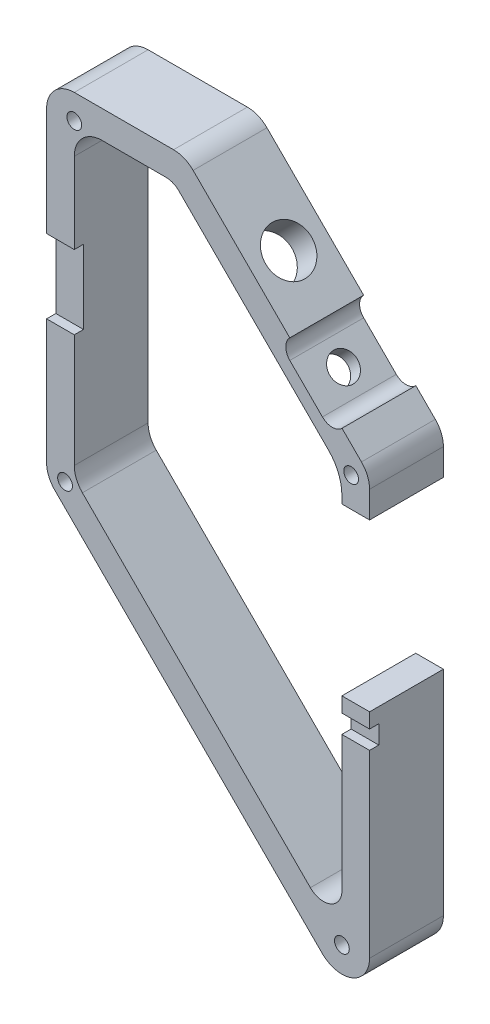
from build123d import *

# Parameters (mm, degrees)
EXTRUDE_1079_DEPTH     = 8
FILLET_4_R             = 3
FILLET_5_R             = 2
SKETCH_13_W            = 3
SKETCH_13_H            = 8
SKETCH_13_H_2          = 2
CUT_EXTRUDE_2700_DEPTH = 1
HOLE_WIZARD_M2_D       = 1.6
FILLET_6_R             = 3
FILLET_7_R             = 5
SKETCH_19_W            = 4
SKETCH_19_H            = 18
CUT_EXTRUDE_4512_DEPTH = 62.155364655
CUT_EXTRUDE_1_REACH    = 71.276
SKETCH_20_R            = 2.5
SKETCH_20_R_2          = 1.5
CUT_EXTRUDE_2_DEPTH    = 62.155364655
FILLET_8_R             = 1.5


with BuildPart() as part:
    # Эскиз8 → Extrude 1079 (new body)
    with BuildSketch(Plane.XY):
        Polygon((0, -18.75), (0, 18.75), (15, 18.75), (35, -1.25), (35, -53.75), align=None)
        Polygon((32, -46.507359313), (3, -17.507359313), (3, 15.75), (13.757359313, 15.75), (32, -2.492640687), align=None, mode=Mode.SUBTRACT)
    extrude(amount=-EXTRUDE_1079_DEPTH)

    # Скругление4
    fillet_4_edges = [part.edges().sort_by_distance(p)[0] for p in [
        (3, -17.507359313, -4),
        (3, 15.75, -4),
        (15, 18.75, -4),
        (35, -1.25, -4),
        (0, -18.75, -4),
        (0, 18.75, -4),
    ]]
    fillet(fillet_4_edges, radius=FILLET_4_R)

    # Скругление5
    fillet_5_edges = [part.edges().sort_by_distance(p)[0] for p in [
        (13.757359313, 15.75, -4),
        (32, -46.507359313, -4),
    ]]
    fillet(fillet_5_edges, radius=FILLET_5_R)

    # Эскиз13 → Cut-Extrude 2700 (cut)
    with BuildSketch(Plane(origin=(0, 0, 0), x_dir=(-1, 0, 0), z_dir=(0, 0, -1))):
        with Locations((-1.5, 0)):
            Rectangle(SKETCH_13_W, SKETCH_13_H)
        with Locations((-33.5, -26)):
            Rectangle(SKETCH_13_W, SKETCH_13_H_2)
    extrude(amount=CUT_EXTRUDE_2700_DEPTH, mode=Mode.SUBTRACT)

    # Крепление рамки M2 (through all)
    with Locations(Plane.XY):
        with Locations((2, -18.3), (3, 16.07), (32, -46.75), (33, -2.17)):
            Hole(HOLE_WIZARD_M2_D / 2)

    # Скругление6
    fillet_6_edges = [part.edges().sort_by_distance(p)[0] for p in [
        (35, -53.75, -4),
    ]]
    fillet(fillet_6_edges, radius=FILLET_6_R)

    # Скругление7
    fillet_7_edges = [part.edges().sort_by_distance(p)[0] for p in [
        (32, -2.492640687, -4),
    ]]
    fillet(fillet_7_edges, radius=FILLET_7_R)

    # Эскиз19 → Cut-Extrude 4512 (cut, through all)
    with BuildSketch(Plane.XY):
        with Locations((33, -14.38)):
            Rectangle(SKETCH_19_W, SKETCH_19_H)
    extrude(amount=-CUT_EXTRUDE_4512_DEPTH, mode=Mode.SUBTRACT)

    # Эскиз20 → Вырез-Вытянуть1 (cut, up to next)
    with BuildSketch(Plane(origin=(16.875, 16.875, 0), x_dir=(0, 0, -1), z_dir=(0.7071067811865488, 0.7071067811865462, 0)), mode=Mode.PRIVATE) as cut_extrude_1_sk1:
        with Locations(Location((4, -7.570990258, 0), (0, 0, 90))):
            Circle(SKETCH_20_R)
    cut_extrude_1_tool1 = extrude(cut_extrude_1_sk1.sketch, amount=-CUT_EXTRUDE_1_REACH, mode=Mode.PRIVATE) & part.part
    # Эскиз20 → Вырез-Вытянуть1 (cut, up to next)
    with BuildSketch(Plane(origin=(16.875, 16.875, 0), x_dir=(0, 0, -1), z_dir=(0.7071067811865488, 0.7071067811865462, 0)), mode=Mode.PRIVATE) as cut_extrude_1_sk2:
        with Locations(Location((4.0519, -17.407536383, 0), (0, 0, 90))):
            Circle(SKETCH_20_R_2)
    cut_extrude_1_tool2 = extrude(cut_extrude_1_sk2.sketch, amount=-CUT_EXTRUDE_1_REACH, mode=Mode.PRIVATE) & part.part
    add(cut_extrude_1_tool1.solids().sort_by_distance((22.228499, 11.521501, -4))[0], mode=Mode.SUBTRACT)
    add(cut_extrude_1_tool2.solids().sort_by_distance((29.183987, 4.566013, -4.0519))[0], mode=Mode.SUBTRACT)

    # Эскиз21 → Вырез-Вытянуть2 (cut, through all)
    with BuildSketch(Plane.XY):
        Polygon((26.355559895, 7.394440105), (25.294899724, 6.333779933), (30.951753973, 0.676925683), (32.012414145, 1.737585855), align=None)
    extrude(amount=-CUT_EXTRUDE_2_DEPTH, mode=Mode.SUBTRACT)

    # Скругление8
    fillet_8_edges = [part.edges().sort_by_distance(p)[0] for p in [
        (30.951753973, 0.676925683, -4),
        (25.294899724, 6.333779933, -4),
    ]]
    fillet(fillet_8_edges, radius=FILLET_8_R - 0.0001)  # a hair under: the kernel refuses the full size


solid = part.part
